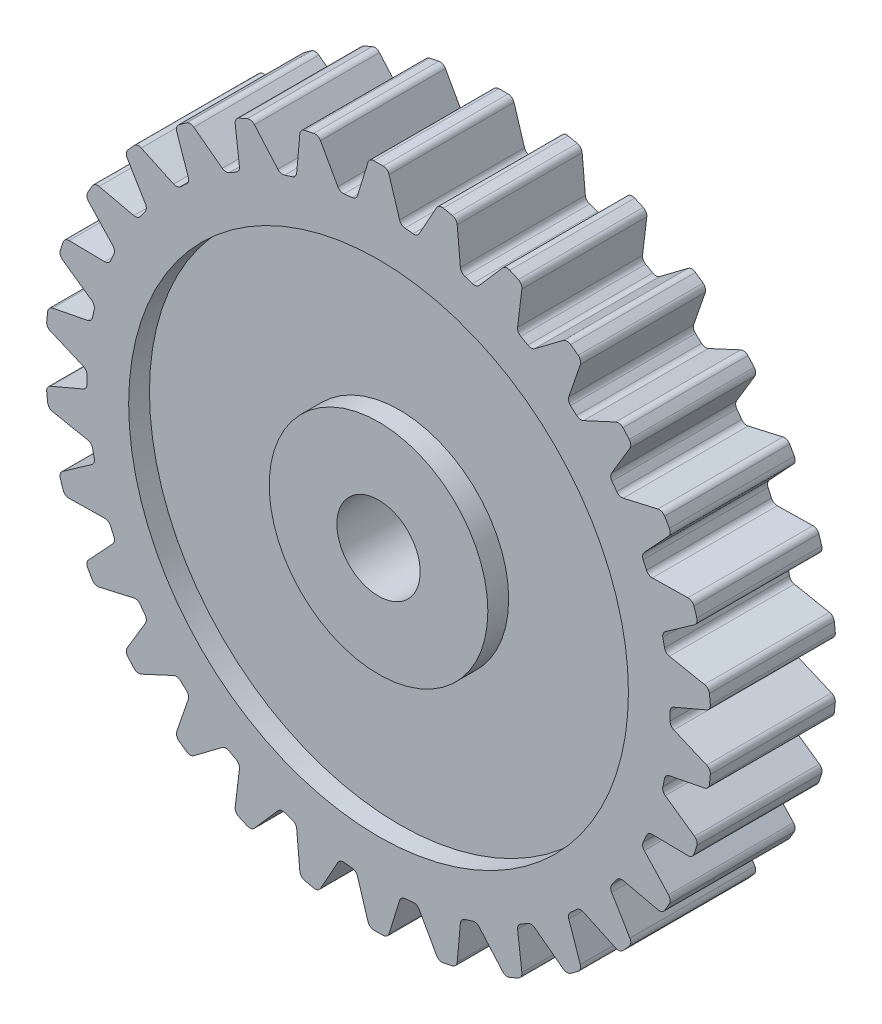
from build123d import *

# Parameters (mm, degrees)
SKETCH1_R                       = 14
BODY_DEPTH                      = 6
TOOTH_DEPTH                     = 6
TOOTH_FILLET_R                  = 0.3
TOOTH_PATTERN_COUNT             = 30
TOOTH_FILLET_OF_TOOTH_PATTERN_R = 0.3
SKETCH3_R                       = 12
SKETCH3_R_2                     = 5.25
RESSES1_DEPTH                   = 1
RESSES2_START                   = -1
SKETCH4_R                       = 12
SKETCH4_R_2                     = 5.25
RESSES2_DEPTH                   = 1
SKETCH5_R                       = 5
BRASS_BOSS_DEPTH                = 5.7
SKETCH6_R                       = 2
BORE_DEPTH                      = 26.432838786
SKETCH7_R                       = 1
GRUB_SCREW_DEPTH                = 26.432838786


with BuildPart() as part:
    # Sketch1 → Body (new body)
    with BuildSketch(Plane.XY):
        Circle(SKETCH1_R)
    extrude(amount=-BODY_DEPTH)

    # Sketch2 → Tooth (add)
    with BuildSketch(Plane.XY):
        with BuildLine():
            Line((-0.755, 14.980987117), (-1.06967171, 13.959075988))
            ThreePointArc((-1.06967171, 13.959075988), (0, 14), (1.06967171, 13.959075988))
            Line((1.06967171, 13.959075988), (0.755, 14.980987117))
            Line((0.755, 14.980987117), (0.443110471, 15.993862983))
            ThreePointArc((0.443110471, 15.993862983), (0, 16), (-0.443110471, 15.993862983))
            Line((-0.443110471, 15.993862983), (-0.755, 14.980987117))
        make_face()
    tooth = extrude(amount=-TOOTH_DEPTH)

    # Tooth Fillet
    tooth_fillet_edges = [part.edges().sort_by_distance(p)[0] for p in [
        (-0.443110471, 15.993862983, -3),
        (-1.06967171, 13.959075988, -3),
        (0.443110471, 15.993862983, -3),
        (1.06967171, 13.959075988, -3),
    ]]
    fillet(tooth_fillet_edges, radius=TOOTH_FILLET_R)

    # Tooth Pattern: Tooth ×30 about axis
    tooth_pattern_axis = Axis((0, 0, 0), (0, 0, 1))
    for i in range(1, TOOTH_PATTERN_COUNT):
        add(tooth.rotate(tooth_pattern_axis, i * 360 / TOOTH_PATTERN_COUNT))

    # Tooth Fillet of Tooth Pattern
    tooth_fillet_of_tooth_pattern_edges = [part.edges().sort_by_distance(p)[0] for p in [
        (-3.75873854, 15.552230856, -3),
        (-3.948551908, 13.431639432, -3),
        (-2.891883651, 15.73648655, -3),
        (-1.855958274, 13.87643394, -3),
        (-6.910091697, 14.430891613, -3),
        (-6.65486144, 12.317175781, -3),
        (-6.100488581, 14.791350144, -3),
        (-4.700473976, 13.187325142, -3),
        (-9.75944069, 12.678853159, -3),
        (-9.070321593, 10.664392444, -3),
        (-9.042472887, 13.199760759, -3),
        (-7.339556409, 11.921866956, -3),
        (-12.182255293, 10.372687982, -3),
        (-11.089365169, 8.545523984, -3),
        (-11.589257737, 11.031278489, -3),
        (-9.657865009, 10.135365976, -3),
        (-14.072646883, 7.613186567, -3),
        (-12.623750274, 6.053175119, -3),
        (-13.629536412, 8.380676416, -3),
        (-11.554078564, 7.905900869, -3),
        (-15.347996276, 4.520952366, -3),
        (-13.606416916, 3.296273456, -3),
        (-15.074138945, 5.363798568, -3),
        (-12.945323443, 5.330909956, -3),
        (-15.952564584, 1.231130854, -3),
        (-13.994417849, 0.395308825, -3),
        (-15.859929271, 2.112496985, -3),
        (-13.770795569, 2.522932698, -3),
        (-15.859929271, -2.112496985, -3),
        (-13.770795569, -2.522932698, -3),
        (-15.952564584, -1.231130854, -3),
        (-13.994417849, -0.395308825, -3),
        (-15.074138945, -5.363798568, -3),
        (-12.945323443, -5.330909956, -3),
        (-15.347996276, -4.520952366, -3),
        (-13.606416916, -3.296273456, -3),
        (-13.629536412, -8.380676416, -3),
        (-11.554078564, -7.905900869, -3),
        (-14.072646883, -7.613186567, -3),
        (-12.623750274, -6.053175119, -3),
        (-11.589257737, -11.031278489, -3),
        (-9.657865009, -10.135365976, -3),
        (-12.182255293, -10.372687982, -3),
        (-11.089365169, -8.545523984, -3),
        (-9.042472887, -13.199760759, -3),
        (-7.339556409, -11.921866956, -3),
        (-9.75944069, -12.678853159, -3),
        (-9.070321593, -10.664392444, -3),
        (-6.100488581, -14.791350144, -3),
        (-4.700473976, -13.187325142, -3),
        (-6.910091697, -14.430891613, -3),
        (-6.65486144, -12.317175781, -3),
        (-2.891883651, -15.73648655, -3),
        (-1.855958274, -13.87643394, -3),
        (-3.75873854, -15.552230856, -3),
        (-3.948551908, -13.431639432, -3),
        (0.443110471, -15.993862983, -3),
        (1.06967171, -13.959075988, -3),
        (-0.443110471, -15.993862983, -3),
        (-1.06967171, -13.959075988, -3),
        (3.75873854, -15.552230856, -3),
        (3.948551908, -13.431639432, -3),
        (2.891883651, -15.73648655, -3),
        (1.855958274, -13.87643394, -3),
        (6.910091697, -14.430891613, -3),
        (6.65486144, -12.317175781, -3),
        (6.100488581, -14.791350144, -3),
        (4.700473976, -13.187325142, -3),
        (9.75944069, -12.678853159, -3),
        (9.070321593, -10.664392444, -3),
        (9.042472887, -13.199760759, -3),
        (7.339556409, -11.921866956, -3),
        (12.182255293, -10.372687982, -3),
        (11.089365169, -8.545523984, -3),
        (11.589257737, -11.031278489, -3),
        (9.657865009, -10.135365976, -3),
        (14.072646883, -7.613186567, -3),
        (12.623750274, -6.053175119, -3),
        (13.629536412, -8.380676416, -3),
        (11.554078564, -7.905900869, -3),
        (15.347996276, -4.520952366, -3),
        (13.606416916, -3.296273456, -3),
        (15.074138945, -5.363798568, -3),
        (12.945323443, -5.330909956, -3),
        (15.952564584, -1.231130854, -3),
        (13.994417849, -0.395308825, -3),
        (15.859929271, -2.112496985, -3),
        (13.770795569, -2.522932698, -3),
        (15.859929271, 2.112496985, -3),
        (13.770795569, 2.522932698, -3),
        (15.952564584, 1.231130854, -3),
        (13.994417849, 0.395308825, -3),
        (15.074138945, 5.363798568, -3),
        (12.945323443, 5.330909956, -3),
        (15.347996276, 4.520952366, -3),
        (13.606416916, 3.296273456, -3),
        (13.629536412, 8.380676416, -3),
        (11.554078564, 7.905900869, -3),
        (14.072646883, 7.613186567, -3),
        (12.623750274, 6.053175119, -3),
        (11.589257737, 11.031278489, -3),
        (9.657865009, 10.135365976, -3),
        (12.182255293, 10.372687982, -3),
        (11.089365169, 8.545523984, -3),
        (9.042472887, 13.199760759, -3),
        (7.339556409, 11.921866956, -3),
        (9.75944069, 12.678853159, -3),
        (9.070321593, 10.664392444, -3),
        (6.100488581, 14.791350144, -3),
        (4.700473976, 13.187325142, -3),
        (6.910091697, 14.430891613, -3),
        (6.65486144, 12.317175781, -3),
        (2.891883651, 15.73648655, -3),
        (1.855958274, 13.87643394, -3),
        (3.75873854, 15.552230856, -3),
        (3.948551908, 13.431639432, -3),
    ]]
    fillet(tooth_fillet_of_tooth_pattern_edges, radius=TOOTH_FILLET_OF_TOOTH_PATTERN_R)

    # Sketch3 → Resses1 (cut)
    with BuildSketch(Plane.XY):
        Circle(SKETCH3_R)
        Circle(SKETCH3_R_2, mode=Mode.SUBTRACT)
    extrude(amount=-RESSES1_DEPTH, mode=Mode.SUBTRACT)

    # Sketch4 → Resses2 (cut)
    with BuildSketch(Plane(origin=(0, 0, -6), x_dir=(-1, 0, 0), z_dir=(0, 0, -1)).offset(RESSES2_START)):
        Circle(SKETCH4_R)
        Circle(SKETCH4_R_2, mode=Mode.SUBTRACT)
    extrude(amount=RESSES2_DEPTH, mode=Mode.SUBTRACT)

    # Sketch5 → Brass boss (add)
    with BuildSketch(Plane(origin=(0, 0, -6), x_dir=(-1, 0, 0), z_dir=(0, 0, -1))):
        Circle(SKETCH5_R)
    extrude(amount=BRASS_BOSS_DEPTH)

    # Sketch6 → Bore (cut, through all)
    with BuildSketch(Plane(origin=(0, 0, -11.7), x_dir=(-1, 0, 0), z_dir=(0, 0, -1))):
        Circle(SKETCH6_R)
    extrude(amount=-BORE_DEPTH, mode=Mode.SUBTRACT)

    # Sketch7 → Grub screw (cut, through all)
    with BuildSketch(Plane(origin=(0, 0, 0), x_dir=(1, 0, 0), z_dir=(0, 1, 0))):
        with Locations((0, 8.862584309)):
            Circle(SKETCH7_R)
    extrude(amount=-GRUB_SCREW_DEPTH, mode=Mode.SUBTRACT)


solid = part.part
